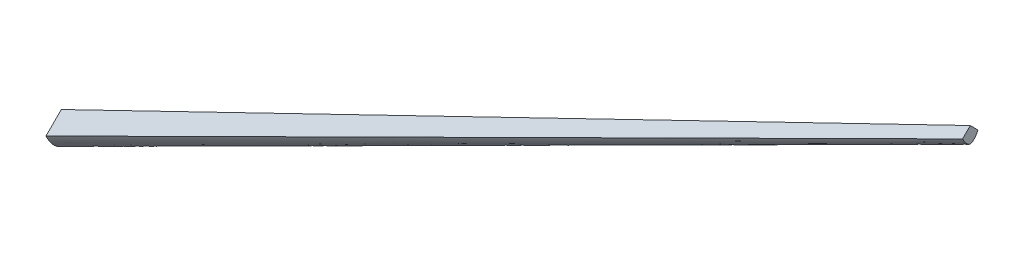
from build123d import *


with BuildPart() as part:
    # 边界1: read off the stored shape, not the designer's step
    # 边界1: loft between two sections, ruled curve by curve
    other_1_from = [
        Edge.make_bspline([(57, 114.4, 0), (57, 114.4, -0.001820958), (57, 114.352907673, -0.005462209), (57, 114.320029662, -0.010907062), (57, 114.249222739, -0.019878571), (57, 114.156548338, -0.032132456), (57, 114.034213823, -0.047441735), (57, 113.88654175, -0.065607247), (57, 113.370012427, -0.127548617), (57, 112.137163028, -0.259027461), (57, 110.501004902, -0.411740073), (57, 108.197187, -0.609641558), (57, 105.449560235, -0.823147067), (57, 101.925918142, -1.053296025), (57, 98.277494458, -1.228543839), (57, 95.54587026, -1.292002462), (57, 93.784319833, -1.289907394), (57, 92.706452955, -1.275561059), (57, 91.44341688, -1.237574119), (57, 89.861087122, -1.144036077), (57, 88.633959438, -1.015878162), (57, 87.732221341, -0.870007472), (57, 87.291174629, -0.784346378), (57, 86.904270346, -0.693141039), (57, 86.573320845, -0.593334554), (57, 86.278541554, -0.47481733), (57, 86.064886191, -0.349405025), (57, 85.915497173, -0.21755301), (57, 85.83987064, -0.125468872), (57, 85.804696915, -0.046646811), (57, 85.798464788, 0), (57, 85.804696915, 0.046646811), (57, 85.83987064, 0.125468872), (57, 85.915497173, 0.21755301), (57, 86.064886191, 0.349405025), (57, 86.278541554, 0.47481733), (57, 86.573320845, 0.593334554), (57, 86.904270346, 0.693141039), (57, 87.291174629, 0.784346378), (57, 87.732221341, 0.870007472), (57, 88.633959438, 1.015878162), (57, 89.861087122, 1.144036077), (57, 91.44341688, 1.237574119), (57, 92.706452955, 1.275561059), (57, 93.784319833, 1.289907394), (57, 95.54587026, 1.292002462), (57, 98.277494458, 1.228543839), (57, 101.925918142, 1.053296025), (57, 105.449560235, 0.823147067), (57, 108.197187, 0.609641558), (57, 110.501004902, 0.411740073), (57, 112.137163028, 0.259027461), (57, 113.370012427, 0.127548617), (57, 113.88654175, 0.065607247), (57, 114.034213823, 0.047441735), (57, 114.156548338, 0.032132456), (57, 114.249222739, 0.019878571), (57, 114.320029662, 0.010907062), (57, 114.352907673, 0.005462209), (57, 114.4, 0.001820958), (57, 114.4, 0)], [0, 0, 0, 0, 0.000711186, 0.001422112, 0.002133252, 0.004251581, 0.006369198, 0.008487526, 0.011973078, 0.033316573, 0.072750533, 0.097133325, 0.153150736, 0.215572756, 0.28012949, 0.342436877, 0.357160037, 0.371419983, 0.398301185, 0.422640862, 0.45355583, 0.462206438, 0.469975829, 0.476836911, 0.482800105, 0.487877314, 0.493276037, 0.495568649, 0.498179926, 0.499405099, 0.5, 0.500594901, 0.501820074, 0.504431351, 0.506723963, 0.512122686, 0.517199895, 0.523163089, 0.530024171, 0.537793562, 0.54644417, 0.577359138, 0.601698815, 0.628580017, 0.642839963, 0.657563123, 0.71987051, 0.784427244, 0.846849264, 0.902866675, 0.927249467, 0.966683427, 0.988026922, 0.991512474, 0.993630802, 0.995748419, 0.997866748, 0.998577888, 0.999288814, 1, 1, 1, 1], 3),
    ]
    other_1_to = [
        Edge.make_bspline([(0, 114.4, 0), (0, 114.4, -0.003641916), (0, 114.305815345, -0.010924418), (0, 114.240059323, -0.021814123), (0, 114.098445477, -0.039757143), (0, 113.913096675, -0.064264912), (0, 113.668427647, -0.09488347), (0, 113.3730835, -0.131214495), (0, 112.340024854, -0.255097235), (0, 109.874326056, -0.518054923), (0, 106.602009805, -0.823480147), (0, 101.994374001, -1.219283117), (0, 96.499120471, -1.646294135), (0, 89.451836285, -2.106592051), (0, 82.154988917, -2.457087677), (0, 76.69174052, -2.584004925), (0, 73.168639667, -2.579814789), (0, 71.01290591, -2.551122119), (0, 68.486833761, -2.475148238), (0, 65.322174244, -2.288072154), (0, 62.867918876, -2.031756324), (0, 61.064442682, -1.740014943), (0, 60.182349259, -1.568692756), (0, 59.408540691, -1.386282078), (0, 58.746641691, -1.186669108), (0, 58.157083107, -0.949634659), (0, 57.729772382, -0.698810051), (0, 57.430994345, -0.43510602), (0, 57.27974128, -0.250937745), (0, 57.209393829, -0.093293621), (0, 57.196929575, 0), (0, 57.209393829, 0.093293621), (0, 57.27974128, 0.250937745), (0, 57.430994345, 0.43510602), (0, 57.729772382, 0.698810051), (0, 58.157083107, 0.949634659), (0, 58.746641691, 1.186669108), (0, 59.408540691, 1.386282078), (0, 60.182349259, 1.568692756), (0, 61.064442682, 1.740014943), (0, 62.867918876, 2.031756324), (0, 65.322174244, 2.288072154), (0, 68.486833761, 2.475148238), (0, 71.01290591, 2.551122119), (0, 73.168639667, 2.579814789), (0, 76.69174052, 2.584004925), (0, 82.154988917, 2.457087677), (0, 89.451836285, 2.106592051), (0, 96.499120471, 1.646294135), (0, 101.994374001, 1.219283117), (0, 106.602009805, 0.823480147), (0, 109.874326056, 0.518054923), (0, 112.340024854, 0.255097235), (0, 113.3730835, 0.131214495), (0, 113.668427647, 0.09488347), (0, 113.913096675, 0.064264912), (0, 114.098445477, 0.039757143), (0, 114.240059323, 0.021814123), (0, 114.305815345, 0.010924418), (0, 114.4, 0.003641916), (0, 114.4, 0)], [0, 0, 0, 0, 0.000711186, 0.001422112, 0.002133252, 0.004251581, 0.006369198, 0.008487526, 0.011973078, 0.033316573, 0.072750533, 0.097133325, 0.153150736, 0.215572756, 0.28012949, 0.342436877, 0.357160037, 0.371419983, 0.398301185, 0.422640862, 0.45355583, 0.462206438, 0.469975829, 0.476836911, 0.482800105, 0.487877314, 0.493276037, 0.495568649, 0.498179926, 0.499405099, 0.5, 0.500594901, 0.501820074, 0.504431351, 0.506723963, 0.512122686, 0.517199895, 0.523163089, 0.530024171, 0.537793562, 0.54644417, 0.577359138, 0.601698815, 0.628580017, 0.642839963, 0.657563123, 0.71987051, 0.784427244, 0.846849264, 0.902866675, 0.927249467, 0.966683427, 0.988026922, 0.991512474, 0.993630802, 0.995748419, 0.997866748, 0.998577888, 0.999288814, 1, 1, 1, 1], 3),
    ]
    other_1 = Solid(Shell([*[Face.make_surface_from_curves(other_1_from[k], other_1_to[k]) for k in range(1)], Face(Wire(other_1_from)), Face(Wire(other_1_to))]))
    add(other_1)

    # 切除-扫描1: sweep along a path in 草图6
    with BuildLine(Plane.XY) as sweep_1_path:
        Line((0, -20), (59.000000002, 8.600000001))
    # 草图12 → 切除-扫描1 (sweep, cut)
    with BuildSketch(Plane(origin=(57, 0, 0), x_dir=(0, 0, -1), z_dir=(1, 0, 0))):
        Polygon((0, 86.8), (-2.862951618, 83.937048382), (-2.862951618, 173.459074824), (3.297160532, 173.459074824), (3.297160532, 83.502839468), align=None)
    sweep(path=sweep_1_path.line, mode=Mode.SUBTRACT)


solid = part.part
